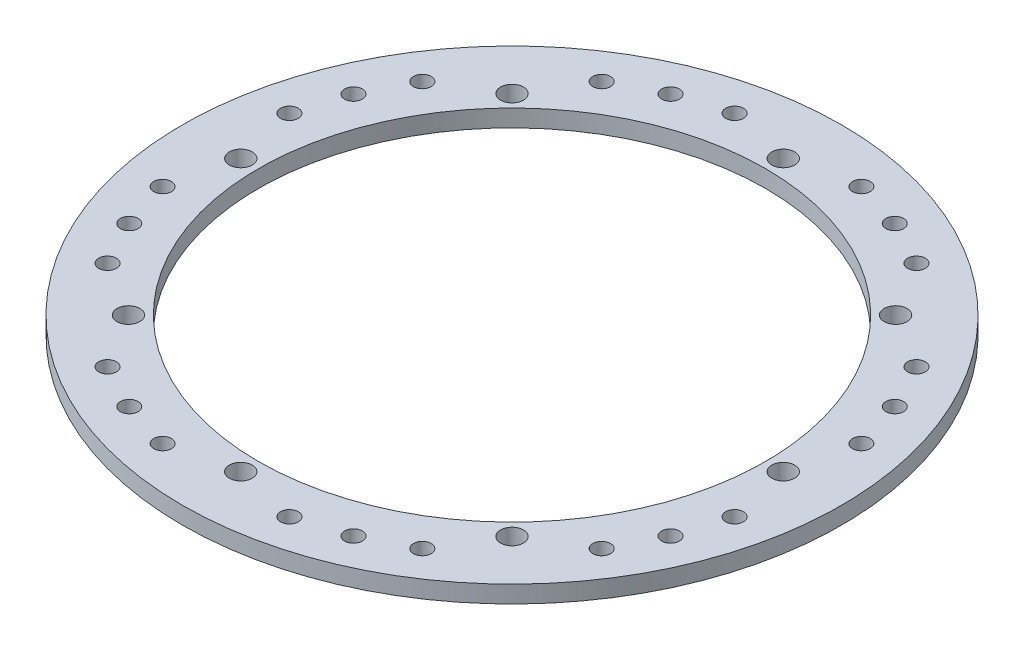
from build123d import *

# Parameters (mm, degrees)
SKETCH1_R                            = 121.5
SKETCH1_R_2                          = 93.5
SKETCH1_R_3                          = 4.2164
BOSS_EXTRUDE1_DEPTH                  = 6.35
STOPING_SCREW_5_16_18_TAPPED_HOLE1_D = 6.5278
STOP_SCREW_CIRPATTERN1_COUNT         = 8
F_5_16_18_TAPPED_HOLE1_OUTLINE_R     = 3.2639
F_5_16_18_TAPPED_HOLE1_DEPTH         = 6.35
CIRPATTERN1_COUNT                    = 8


# Read off the part's stored shape, not the designer's step: 5/16-18 Tapped Hole1
with BuildPart() as part:
    # Sketch1 → Boss-Extrude1 (new body)
    with BuildSketch(Plane(origin=(0, 0, 0), x_dir=(1, 0, 0), z_dir=(0, 1, 0))):
        with Locations(Location((0, 0, 0), (0, 0, 270))):
            Circle(SKETCH1_R)
        with Locations(Location((0, 0, 0), (0, 0, 270))):
            Circle(SKETCH1_R_2, mode=Mode.SUBTRACT)
        with Locations(Location((0, 100, 0), (0, 0, 270))):
            Circle(SKETCH1_R_3, mode=Mode.SUBTRACT)
        with Locations(Location((70.710678119, 70.710678119, 0), (0, 0, 270))):
            Circle(SKETCH1_R_3, mode=Mode.SUBTRACT)
        with Locations(Location((100, 0, 0), (0, 0, 270))):
            Circle(SKETCH1_R_3, mode=Mode.SUBTRACT)
        with Locations(Location((70.710678119, -70.710678119, 0), (0, 0, 270))):
            Circle(SKETCH1_R_3, mode=Mode.SUBTRACT)
        with Locations(Location((0, -100, 0), (0, 0, 270))):
            Circle(SKETCH1_R_3, mode=Mode.SUBTRACT)
        with Locations(Location((-70.710678119, -70.710678119, 0), (0, 0, 270))):
            Circle(SKETCH1_R_3, mode=Mode.SUBTRACT)
        with Locations(Location((-100, 0, 0), (0, 0, 270))):
            Circle(SKETCH1_R_3, mode=Mode.SUBTRACT)
        with Locations(Location((-70.710678119, 70.710678119, 0), (0, 0, 270))):
            Circle(SKETCH1_R_3, mode=Mode.SUBTRACT)
    extrude(amount=BOSS_EXTRUDE1_DEPTH)

    # Stoping_Screw_5/16-18 Tapped Hole1 (through all)
    with Locations(Plane(origin=(41.329810695, 6.35, 99.778989511), x_dir=(0, 0, 1), z_dir=(0, 1, 0))):
        with Locations((0, 0)):
            stoping_screw_5_16_18_tapped_hole1 = Hole(STOPING_SCREW_5_16_18_TAPPED_HOLE1_D / 2)

    # Stop_Screw_CirPattern1: Stoping_Screw_5/16-18 Tapped Hole1 ×8 about axis
    stop_screw_cirpattern1_axis = Axis((0, 0, 0), (0, 1, 0))
    for i in range(1, STOP_SCREW_CIRPATTERN1_COUNT):
        add(stoping_screw_5_16_18_tapped_hole1.rotate(stop_screw_cirpattern1_axis, i * 360 / STOP_SCREW_CIRPATTERN1_COUNT), mode=Mode.SUBTRACT)

    # 5/16-18 Tapped Hole1 outline → 5/16-18 Tapped Hole1 (cut)
    with BuildSketch(Plane(origin=(0, 0, 0), x_dir=(1, 0, 0), z_dir=(0, 1, 0))):
        with Locations((58.028357701, -91.086276148)):
            Circle(F_5_16_18_TAPPED_HOLE1_OUTLINE_R)
        with Locations((23.375478305, -105.439968769)):
            Circle(F_5_16_18_TAPPED_HOLE1_OUTLINE_R)
    f_5_16_18_tapped_hole1 = extrude(amount=F_5_16_18_TAPPED_HOLE1_DEPTH, mode=Mode.SUBTRACT)

    # CirPattern1: 5/16-18 Tapped Hole1 ×8 about axis
    cirpattern1_axis = Axis((0, 0, 0), (0, 1, 0))
    for i in range(1, CIRPATTERN1_COUNT):
        add(f_5_16_18_tapped_hole1.rotate(cirpattern1_axis, i * 360 / CIRPATTERN1_COUNT), mode=Mode.SUBTRACT)


solid = part.part
